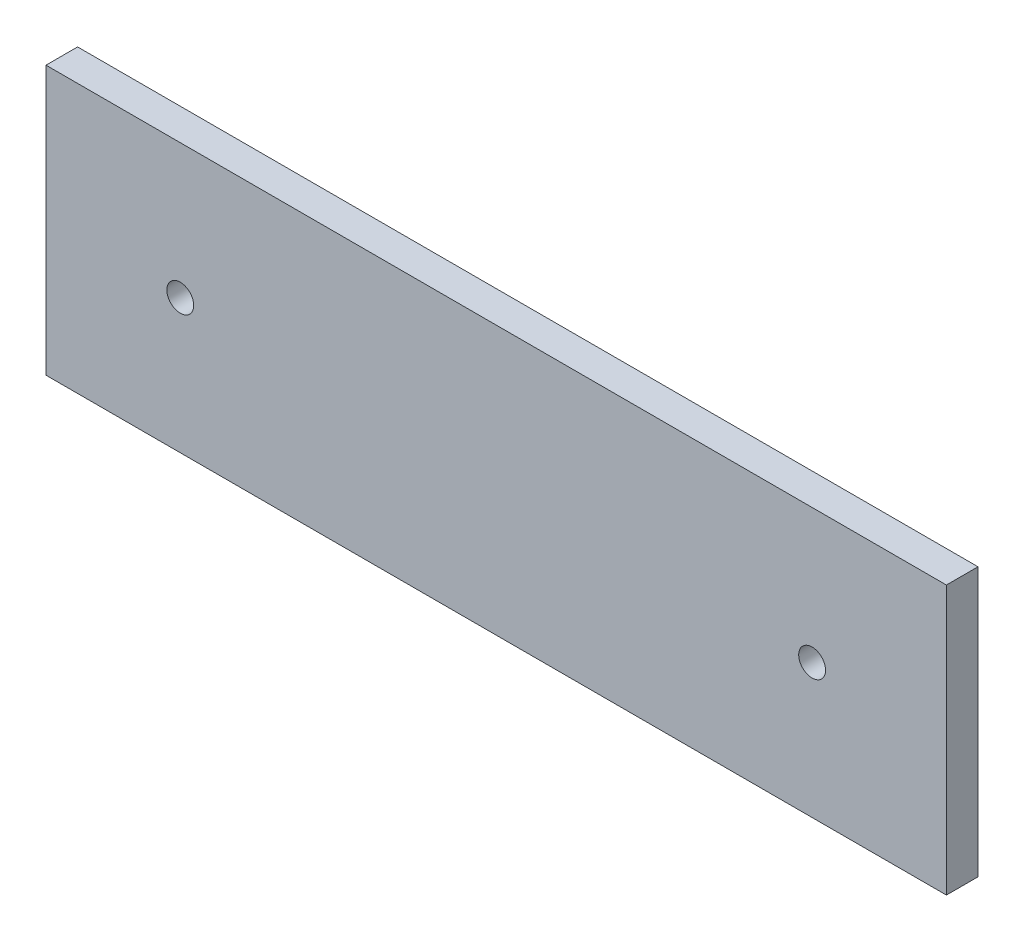
from build123d import *

# Parameters (mm, degrees)
SKETCH_1_W      = 114
SKETCH_1_H      = 34
SKETCH_1_R      = 1.7
EXTRUDE_1_DEPTH = 2


with BuildPart() as part:
    # 草图1 → 凸台-拉伸1 (new, symmetric)
    with BuildSketch(Plane.XY):
        with Locations((40, 0)):
            Rectangle(SKETCH_1_W, SKETCH_1_H)
        Circle(SKETCH_1_R, mode=Mode.SUBTRACT)
        with Locations((80, 0)):
            Circle(SKETCH_1_R, mode=Mode.SUBTRACT)
    extrude(amount=EXTRUDE_1_DEPTH, both=True)


solid = part.part
